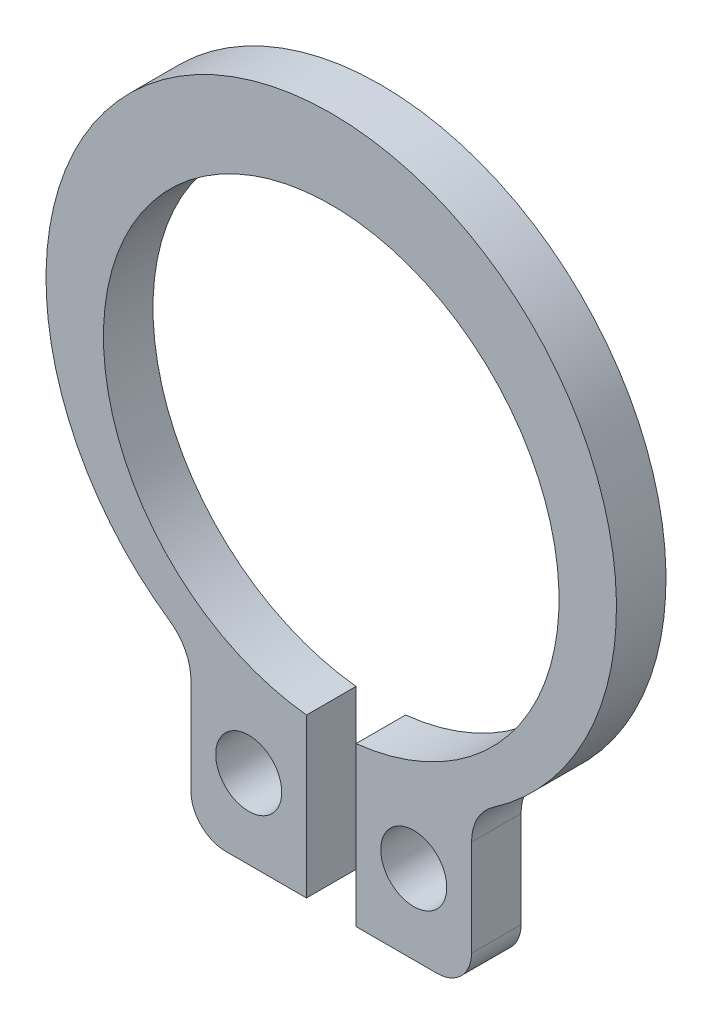
from build123d import *

# Parameters (mm, degrees)
BODYSKE_R      = 1
BASEBODY_DEPTH = 1.5
FILLET1_R      = 1.5
FILLET2_R      = 1.05


with BuildPart() as part:
    # BodySke → BaseBody (new body)
    with BuildSketch(Plane.XY):
        with BuildLine():
            Line((-0.75, -6.859118019), (-0.75, -11.659118019))
            Line((-0.75, -11.659118019), (-4.25, -11.659118019))
            Line((-4.25, -11.659118019), (-4.25, -6.862439764))
            ThreePointArc((-4.25, -6.862439764), (0, 9.3), (4.25, -6.862439764))
            Line((4.25, -6.862439764), (4.25, -11.659118019))
            Line((4.25, -11.659118019), (0.75, -11.659118019))
            Line((0.75, -11.659118019), (0.75, -6.859118019))
            ThreePointArc((0.75, -6.859118019), (0, 6.9), (-0.75, -6.859118019))
        make_face()
        with Locations((-2.5, -9.260778891)):
            Circle(BODYSKE_R, mode=Mode.SUBTRACT)
        with Locations((2.5, -9.260778891)):
            Circle(BODYSKE_R, mode=Mode.SUBTRACT)
    extrude(amount=BASEBODY_DEPTH)

    # Fillet1
    fillet1_edges = [part.edges().sort_by_distance(p)[0] for p in [
        (4.25, -6.862439764, 0.75),
        (-4.25, -6.862439764, 0.75),
    ]]
    fillet(fillet1_edges, radius=FILLET1_R)

    # Fillet2
    fillet2_edges = [part.edges().sort_by_distance(p)[0] for p in [
        (4.25, -11.659118019, 0.75),
        (-4.25, -11.659118019, 0.75),
    ]]
    fillet(fillet2_edges, radius=FILLET2_R)


solid = part.part
